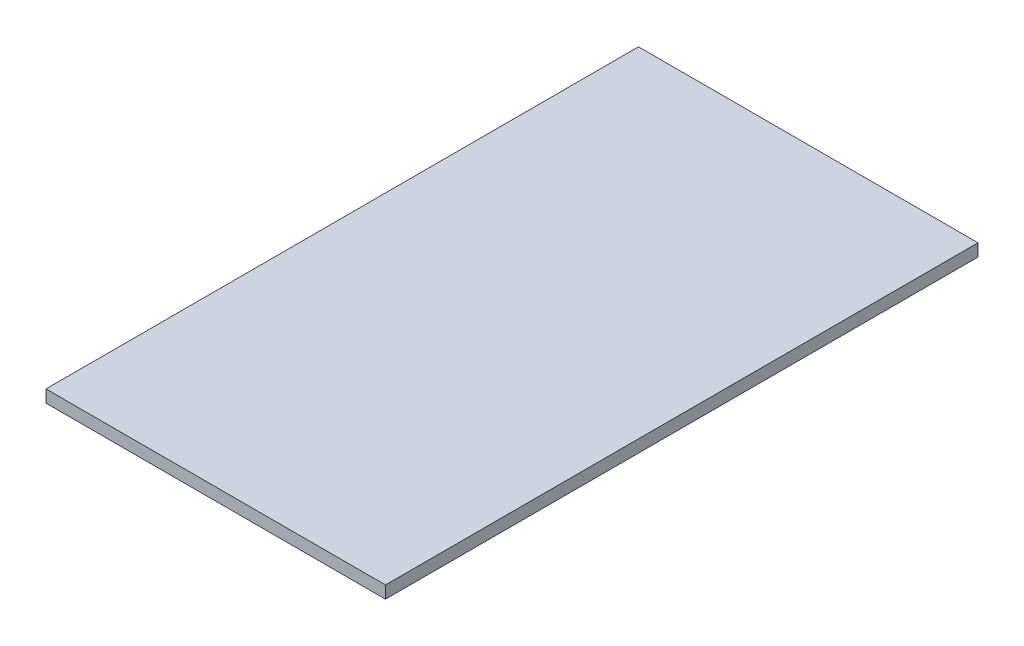
from build123d import *

# Parameters (mm, degrees)
SKETCH2_W           = 55
SKETCH2_H           = 96
BOSS_EXTRUDE1_DEPTH = 2


with BuildPart() as part:
    # Sketch2 → Boss-Extrude1 (new body)
    with BuildSketch(Plane(origin=(0, 0, 0), x_dir=(1, 0, 0), z_dir=(0, 1, 0))):
        with Locations((27.5, 48)):
            Rectangle(SKETCH2_W, SKETCH2_H)
    extrude(amount=BOSS_EXTRUDE1_DEPTH)


solid = part.part
